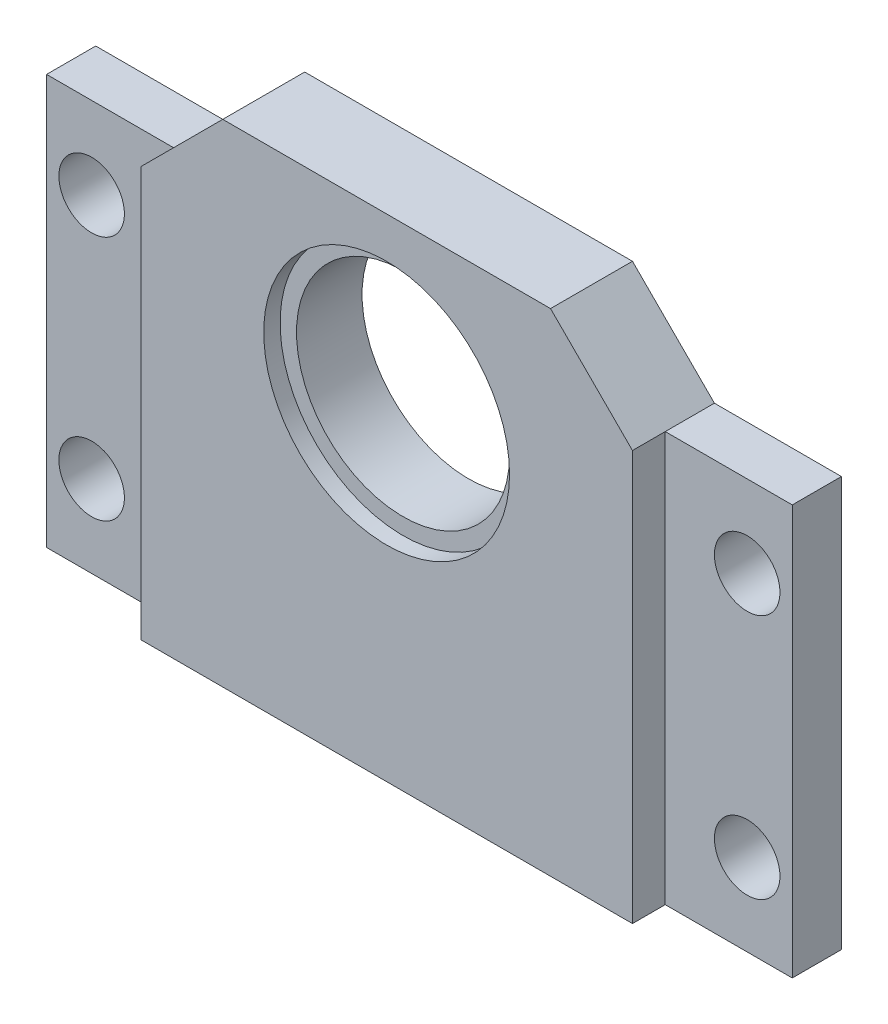
from build123d import *
from build123d.topology import SkipClean

# Parameters (mm, degrees)
ESQUISSE1_W             = 45.5
ESQUISSE1_H             = 25
BOSS_EXTRU_1_DEPTH      = 3
ESQUISSE2_R             = 2
ENL_V_MAT_EXTRU_1_DEPTH = 3
ESQUISSE4_W             = 20
ESQUISSE4_H             = 5
BOSS_EXTRU_2_DEPTH      = 3
ESQUISSE3_R             = 6.5
ENL_V_MAT_EXTRU_2_DEPTH = 55.582506355
CHANFREIN1_SIZE         = 5
BOSS_EXTRU_3_START      = 2
ESQUISSE5_R             = 6.5
BOSS_EXTRU_3_DEPTH      = 2
ESQUISSE6_R             = 7.5
ENL_V_MAT_EXTRU_3_DEPTH = 1


with BuildPart() as part:
    # Esquisse1 → Boss.-Extru.1 (new body)
    with BuildSketch(Plane.XY):
        with Locations((22.75, 12.5)):
            Rectangle(ESQUISSE1_W, ESQUISSE1_H)
    extrude(amount=BOSS_EXTRU_1_DEPTH)

    # Esquisse2 → Enlèv. mat.-Extru.1 (cut)
    with BuildSketch(Plane.XY.offset(3)):
        with Locations((2.75, 20)):
            Circle(ESQUISSE2_R)
        with Locations(Location((42.75, 20, 0), (0, 0, 180))):
            Circle(ESQUISSE2_R)
        with Locations((42.75, 5)):
            Circle(ESQUISSE2_R)
        with Locations(Location((2.75, 5, 0), (0, 0, 180))):
            Circle(ESQUISSE2_R)
    extrude(amount=-ENL_V_MAT_EXTRU_1_DEPTH, mode=Mode.SUBTRACT)

    # Esquisse4 → Boss.-Extru.2 (add)
    with BuildSketch(Plane.XY.offset(3)):
        with Locations((22.75, 27.5)):
            Rectangle(ESQUISSE4_W, ESQUISSE4_H)
    extrude(amount=-BOSS_EXTRU_2_DEPTH)

    # Esquisse3 → Enlèv. mat.-Extru.2 (cut, through all)
    with BuildSketch(Plane.XY.offset(3)):
        with Locations((22.75, 20)):
            Circle(ESQUISSE3_R)
    extrude(amount=-ENL_V_MAT_EXTRU_2_DEPTH, mode=Mode.SUBTRACT)

    # Chanfrein1
    chanfrein1_edges = [part.edges().sort_by_distance(p)[0] for p in [
        (32.75, 25, 1.5),
        (12.75, 25, 1.5),
    ]]
    chamfer(chanfrein1_edges, length=CHANFREIN1_SIZE - 0.0001)  # a hair under: the kernel refuses the full size

    # Esquisse5 → Boss.-Extru.3 (add)
    with SkipClean():  # the faces are left unmerged after this step: merging them gives an invalid solid
        with BuildSketch(Plane.XY.offset(3).offset(BOSS_EXTRU_3_START)):
            Polygon((32.75, 30), (12.75, 30), (7.75, 25), (7.75, 0), (37.75, 0), (37.75, 25), align=None)
            with Locations((22.75, 20)):
                Circle(ESQUISSE5_R, mode=Mode.SUBTRACT)
        extrude(amount=-BOSS_EXTRU_3_DEPTH)

    # Esquisse6 → Enlèv. mat.-Extru.3 (cut)
    with SkipClean():  # the faces are left unmerged after this step: merging them gives an invalid solid
        with BuildSketch(Plane.XY.offset(5)):
            with Locations((22.75, 20)):
                Circle(ESQUISSE6_R)
        extrude(amount=-ENL_V_MAT_EXTRU_3_DEPTH, mode=Mode.SUBTRACT)


solid = part.part
